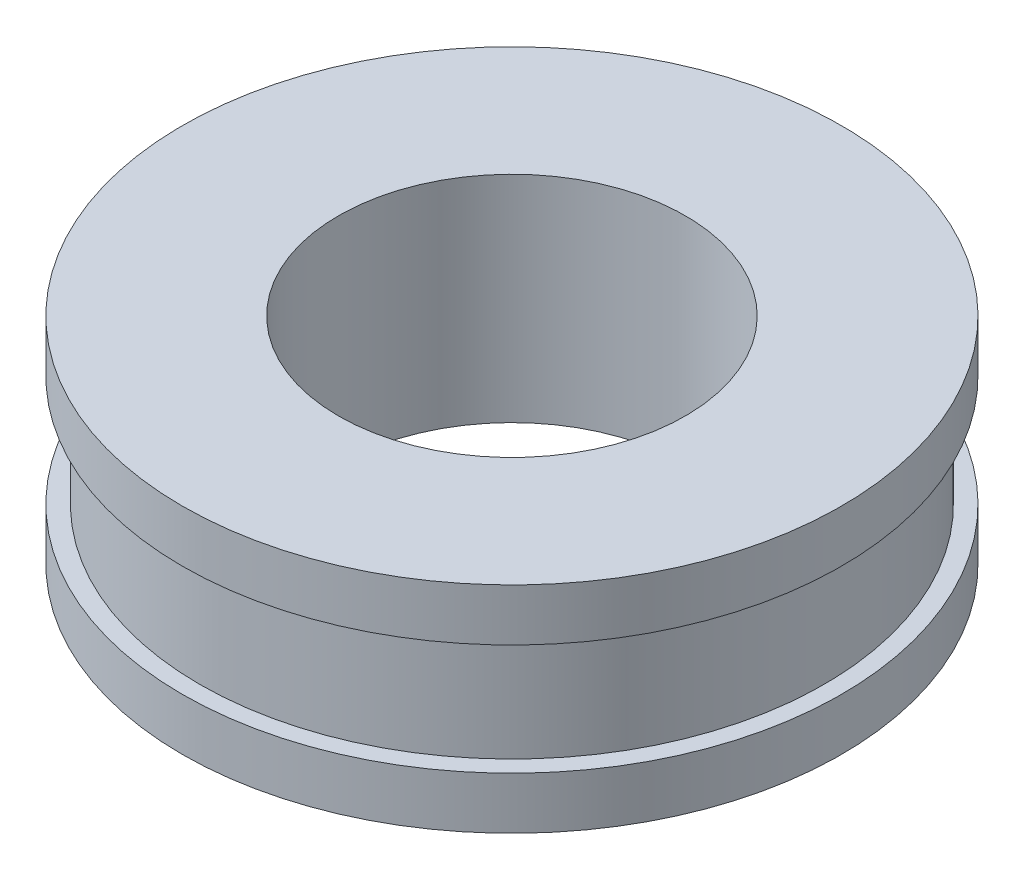
from build123d import *

# Parameters (mm, degrees)
SKETCH1_R           = 47.5
SKETCH1_R_2         = 25
BOSS_EXTRUDE1_DEPTH = 15.5
SKETCH3_R           = 47.5
SKETCH3_R_2         = 45
CUT_EXTRUDE1_DEPTH  = 8


with BuildPart() as part:
    # Sketch1 → Boss-Extrude1 (new, symmetric)
    with BuildSketch(Plane(origin=(0, 0, 0), x_dir=(1, 0, 0), z_dir=(0, 1, 0))):
        Circle(SKETCH1_R)
        Circle(SKETCH1_R_2, mode=Mode.SUBTRACT)
    extrude(amount=BOSS_EXTRUDE1_DEPTH, both=True)

    # Sketch3 → Cut-Extrude1 (cut, symmetric)
    with BuildSketch(Plane(origin=(0, 0, 0), x_dir=(1, 0, 0), z_dir=(0, 1, 0))):
        Circle(SKETCH3_R)
        Circle(SKETCH3_R_2, mode=Mode.SUBTRACT)
    extrude(amount=CUT_EXTRUDE1_DEPTH, both=True, mode=Mode.SUBTRACT)


solid = part.part
